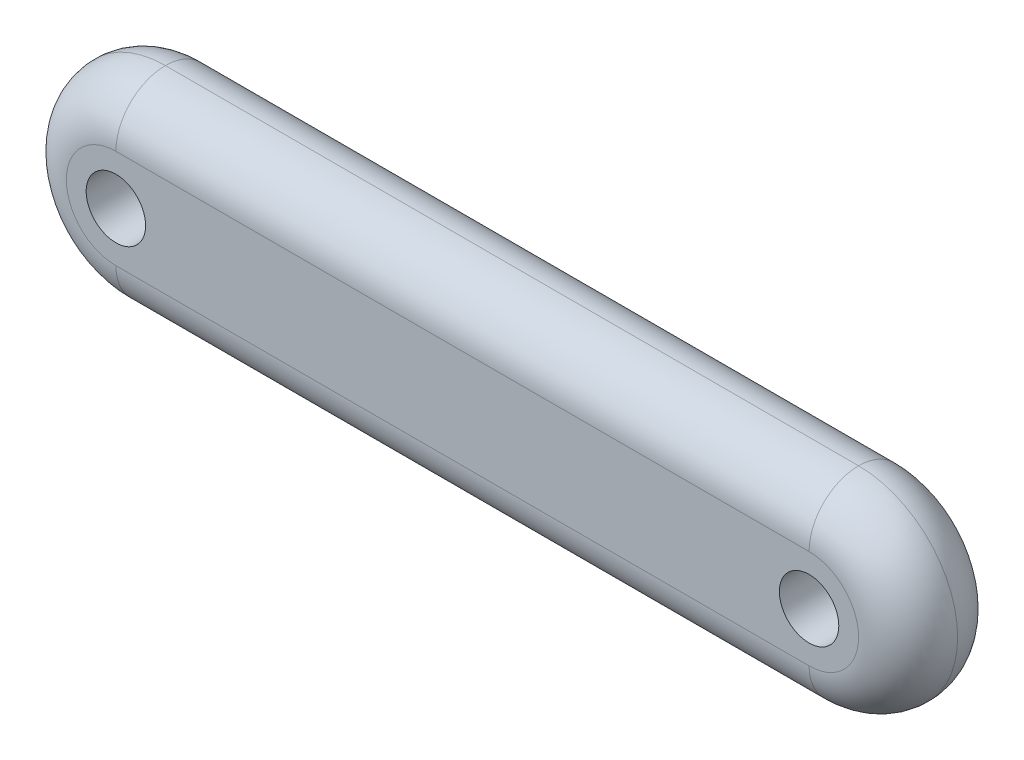
from build123d import *

# Parameters (mm, degrees)
SKETCH1_R           = 6
BOSS_EXTRUDE2_DEPTH = 20
SKETCH3_R           = 10
BOSS_EXTRUDE3_DEPTH = 3
FILLET1_R           = 10
FILLET2_R           = 10


with BuildPart() as part:
    # Sketch1 → Boss-Extrude2 (new body)
    with BuildSketch(Plane.XY):
        with BuildLine():
            Line((-70, 20), (70, 20))
            ThreePointArc((70, 20), (90, 0), (70, -20))
            Line((70, -20), (-70, -20))
            ThreePointArc((-70, -20), (-90, 0), (-70, 20))
        make_face()
        with Locations((-70, 0)):
            Circle(SKETCH1_R, mode=Mode.SUBTRACT)
        with Locations((70, 0)):
            Circle(SKETCH1_R, mode=Mode.SUBTRACT)
    extrude(amount=BOSS_EXTRUDE2_DEPTH)

    # Sketch3 → Boss-Extrude3 (add)
    with BuildSketch(Plane.XY):
        with Locations((-70, 0)):
            Circle(SKETCH3_R)
        with Locations((70, 0)):
            Circle(SKETCH3_R)
    extrude(amount=BOSS_EXTRUDE3_DEPTH)

    # Fillet1
    fillet1_edges = [part.edges().sort_by_distance(p)[0] for p in [
        (90, 0, 20),
        (0, 20, 20),
        (-90, 0, 20),
        (0, -20, 20),
    ]]
    fillet(fillet1_edges, radius=FILLET1_R)

    # Fillet2
    fillet2_edges = [part.edges().sort_by_distance(p)[0] for p in [
        (90, 0, 0),
        (0, -20, 0),
        (-90, 0, 0),
        (0, 20, 0),
    ]]
    fillet(fillet2_edges, radius=FILLET2_R - 0.0001)  # a hair under: the kernel refuses the full size


solid = part.part
